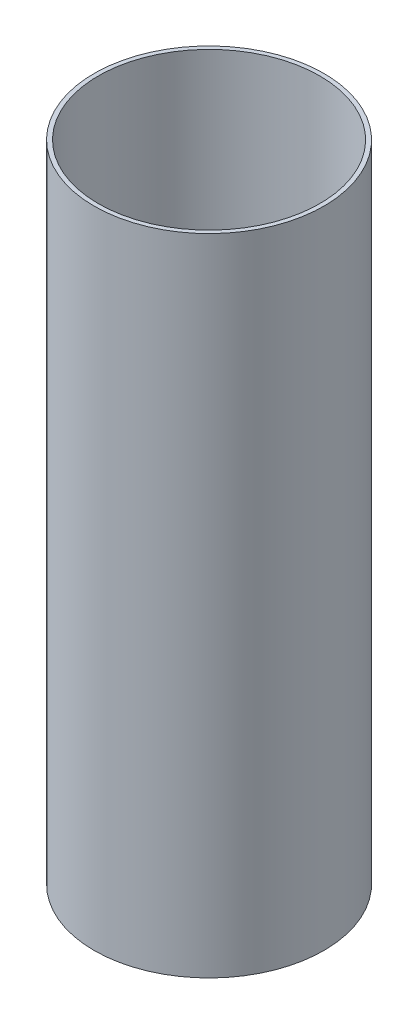
from build123d import *

# Parameters (mm, degrees)
SKETCH1_R           = 41
SKETCH1_R_2         = 39.5
BOSS_EXTRUDE1_DEPTH = 230


with BuildPart() as part:
    # Sketch1 → Boss-Extrude1 (new body)
    with BuildSketch(Plane(origin=(0, 0, 0), x_dir=(1, 0, 0), z_dir=(0, 1, 0))):
        Circle(SKETCH1_R)
        Circle(SKETCH1_R_2, mode=Mode.SUBTRACT)
    extrude(amount=BOSS_EXTRUDE1_DEPTH)


solid = part.part
